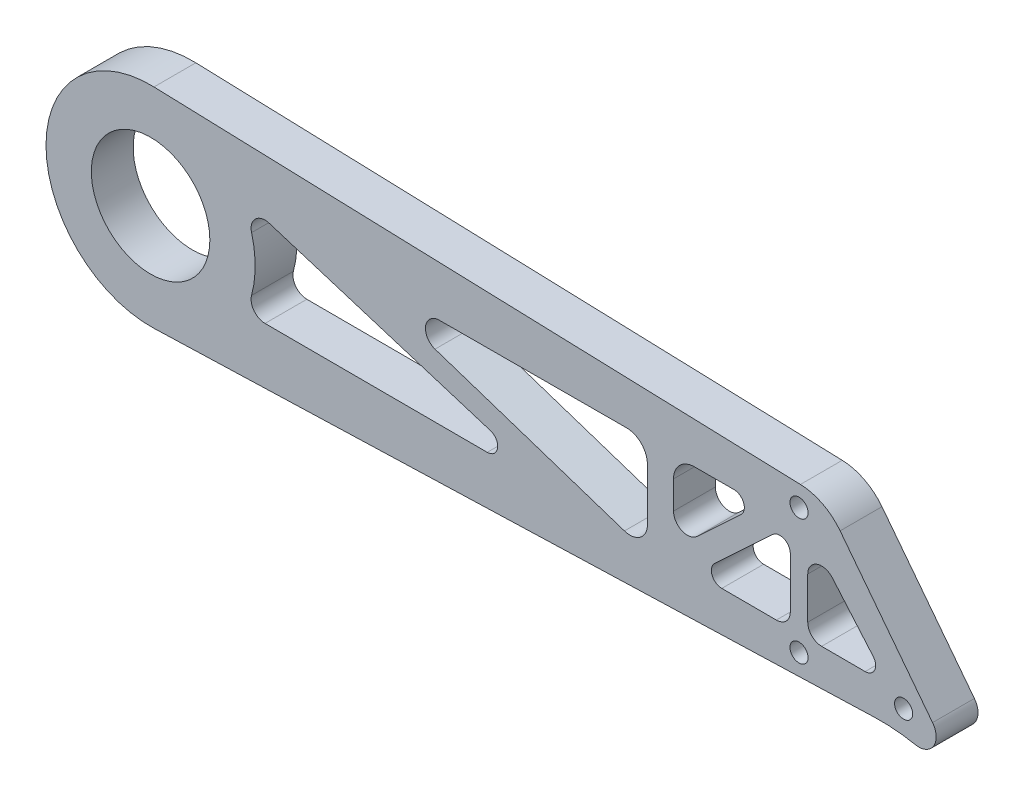
from build123d import *

# Parameters (mm, degrees)
SKETCH_1_R           = 2.6
EXTRUDE_1_DEPTH      = 12
SKETCH_2_R           = 17
CUT_EXTRUDE_1_DEPTH  = 319.424245308
FILLET_1_R           = 50
SKETCH_7_R           = 21
CUT_EXTRUDE_6_DEPTH  = 319.424245308
SKETCH_15_R          = 48
CUT_EXTRUDE_12_DEPTH = 319.424245308
CUT_EXTRUDE_13_DEPTH = 234.372713636
CUT_EXTRUDE_14_DEPTH = 234.372713636
SKETCH_19_W          = 9.577046033
SKETCH_19_H          = 9.102233312
EXTRUDE_3_DEPTH      = 1
CUT_EXTRUDE_16_DEPTH = 234.372713636
FILLET_11_R          = 5
FILLET_12_R          = 15
FILLET_13_R          = 5


with BuildPart() as part:
    # 草图1 → 凸台-拉伸1 (new body)
    with BuildSketch(Plane.XY):
        with BuildLine():
            Line((0.975449173, 29.984137455), (231.02885683, 22.5))
            ThreePointArc((231.02885683, 22.5), (315, 0), (231.02885683, -22.5))
            Line((231.02885683, -22.5), (0.975449173, -29.984137455))
            ThreePointArc((0.975449173, -29.984137455), (-30, 0), (0.975449173, 29.984137455))
        make_face()
        with Locations((186, 18)):
            Circle(SKETCH_1_R, mode=Mode.SUBTRACT)
        with Locations(Location((186, -18, 0), (0, 0, 180))):
            Circle(SKETCH_1_R, mode=Mode.SUBTRACT)
        with Locations((216, -16.952376915)):
            Circle(SKETCH_1_R, mode=Mode.SUBTRACT)
    extrude(amount=EXTRUDE_1_DEPTH)

    # 草图2 → 切除-拉伸1 (cut, through all)
    with BuildSketch(Plane.XY.offset(12)):
        Circle(SKETCH_2_R)
    extrude(amount=-CUT_EXTRUDE_1_DEPTH, mode=Mode.SUBTRACT)

    # Fillet 1
    fillet_1_edges = [part.edges().sort_by_distance(p)[0] for p in [
        (231.02885683, 22.5, 6),
        (231.02885683, -22.5, 6),
    ]]
    fillet(fillet_1_edges, radius=FILLET_1_R)

    # 草图7 → 切除-拉伸6 (cut, through all)
    with BuildSketch(Plane.XY.offset(12)):
        with Locations((270, 0)):
            Circle(SKETCH_7_R)
    extrude(amount=-CUT_EXTRUDE_6_DEPTH, mode=Mode.SUBTRACT)

    # 草图15 → 切除-拉伸12 (cut, through all)
    with BuildSketch(Plane(origin=(0, 0, 0), x_dir=(-1, 0, 0), z_dir=(0, 0, -1))):
        with Locations((-270, 0)):
            Circle(SKETCH_15_R)
    extrude(amount=-CUT_EXTRUDE_12_DEPTH, mode=Mode.SUBTRACT)

    # 草图16 → 切除-拉伸13 (cut, through all)
    with BuildSketch(Plane(origin=(0, 0, 0), x_dir=(-1, 0, 0), z_dir=(0, 0, -1))):
        with BuildLine():
            ThreePointArc((-222, 0), (-224.338232659, 14.798750059), (-231.125125138, 28.155711755))
            ThreePointArc((-231.125125138, 28.155711755), (-223.636221951, 25.273493876), (-215.782692909, 23.62639569))
            ThreePointArc((-215.782692909, 23.62639569), (-220.419657795, 12.215374337), (-222, 0))
        make_face()
    extrude(amount=-CUT_EXTRUDE_13_DEPTH, mode=Mode.SUBTRACT)

    # 草图17 → 切除-拉伸14 (cut, through all)
    with BuildSketch(Plane(origin=(0, 0, 0), x_dir=(-1, 0, 0), z_dir=(0, 0, -1))):
        with BuildLine():
            ThreePointArc((-188.5, 2.750055906), (-191.110952969, 6.501128866), (-195.535274173, 5.355264285))
            Line((-195.535274173, 5.355264285), (-207.249830265, -8.293121713))
            ThreePointArc((-207.249830265, -8.293121713), (-207.697838632, -11.502932426), (-204.966217001, -13.247019458))
            Line((-204.966217001, -13.247019458), (-192.490456487, -13.217253727))
            ThreePointArc((-192.490456487, -13.217253727), (-189.668200744, -12.04231608), (-188.5, -9.217265111))
            Line((-188.5, -9.217265111), (-188.5, 2.750055906))
        make_face()
        with BuildLine():
            ThreePointArc((-178.455108958, 7.554652032), (-181.696939195, 8.110441149), (-183.5, 5.359561914))
            Line((-183.5, 5.359561914), (-183.5, -9.186248604))
            ThreePointArc((-183.5, -9.186248604), (-182.325050968, -12.018047861), (-179.490456487, -13.18623722))
            Line((-179.490456487, -13.18623722), (-163.845250629, -13.148909555))
            ThreePointArc((-163.845250629, -13.148909555), (-161.059570263, -11.244388724), (-161.807517222, -7.953827976))
            Line((-161.807517222, -7.953827976), (-178.455108958, 7.554652032))
        make_face()
        with BuildLine():
            Line((-155.98568473, 13.130157534), (-167.304455128, 13.15716282))
            ThreePointArc((-167.304455128, 13.15716282), (-170.101829155, 11.259302243), (-169.356503805, 7.96208124))
            Line((-169.356503805, 7.96208124), (-156.726521389, -3.803694429))
            ThreePointArc((-156.726521389, -3.803694429), (-152.404081073, -4.544746584), (-150, -0.876907605))
            Line((-150, -0.876907605), (-150, 7.130174611))
            ThreePointArc((-150, 7.130174611), (-151.752301116, 11.367751063), (-155.98568473, 13.130157534))
        make_face()
        with BuildLine():
            ThreePointArc((-136.48568473, 13.083632773), (-140.737576452, 11.331348735), (-142.5, 7.083649851))
            Line((-142.5, 7.083649851), (-142.5, -8.086038582))
            ThreePointArc((-142.5, -8.086038582), (-140.427707672, -12.139250616), (-135.928588884, -12.832686568))
            Line((-135.928588884, -12.832686568), (-81.584472606, 5.158314378))
            ThreePointArc((-81.584472606, 5.158314378), (-78.891840256, 9.587602802), (-82.832057986, 12.955621382))
            Line((-82.832057986, 12.955621382), (-136.48568473, 13.083632773))
        make_face()
        with BuildLine():
            ThreePointArc((-97.462029586, -7.12436313), (-99.534348383, -10.443548142), (-96.561920261, -12.988379256))
            Line((-96.561920261, -12.988379256), (-32.822141486, -12.836303465))
            ThreePointArc((-32.822141486, -12.836303465), (-29.654019481, -11.265809006), (-28.969133823, -7.796748397))
            ThreePointArc((-28.969133823, -7.796748397), (-30, 0), (-28.969133823, 7.796748397))
            ThreePointArc((-28.969133823, 7.796748397), (-30.059408875, 11.719799736), (-34.022287252, 12.655014403))
            Line((-34.022287252, 12.655014403), (-97.462029586, -7.12436313))
        make_face()
    extrude(amount=-CUT_EXTRUDE_14_DEPTH, mode=Mode.SUBTRACT)

    # 草图21 → 切除-拉伸16 (cut, through all)
    with BuildSketch(Plane.XY.offset(12)):
        with BuildLine():
            Line((225.346998742, -17.609925571), (193.471450892, 23.72182406))
            Line((193.471450892, 23.72182406), (207.853731728, 23.253937199))
            ThreePointArc((207.853731728, 23.253937199), (211.825615161, 23.282573441), (215.782692909, 23.62639569))
            ThreePointArc((215.782692909, 23.62639569), (220.419657795, 12.215374337), (222, 0))
            ThreePointArc((222, 0), (222.844172892, -8.962587227), (225.346998742, -17.609925571))
        make_face()
    extrude(amount=-CUT_EXTRUDE_16_DEPTH, mode=Mode.SUBTRACT)

    # 圆角11
    # the kernel refuses this fillet: 5 mm, written as the material it takes off along each edge
    with BuildSketch(Plane(origin=(231.125125138, -28.155711755, -30.280019258), x_dir=(-0.9472337070589926, 0.3205437633323705, 0), z_dir=(0, 0, 1))) as fillet_11_piece_1:
        with BuildLine():
            CenterArc((12.717608088, -4.963189315), FILLET_11_R, 96.956749804, 123.184808142)
            ThreePointArc((8.895338078, -8.186580691), (4.706429893, -3.812127139), (0, 0))
            ThreePointArc((0, 0), (6.056003852, -0.368106853), (12.112007703, 0))
        make_face()
    extrude(amount=72.560038515, mode=Mode.SUBTRACT)

    # 圆角12
    fillet_12_edges = [part.edges().sort_by_distance(p)[0] for p in [
        (193.471450892, 23.72182406, 6),
    ]]
    fillet(fillet_12_edges, radius=FILLET_12_R)

    # 圆角13
    fillet_13_edges = [part.edges().sort_by_distance(p)[0] for p in [
        (225.346030547, -17.608670152, 6),
    ]]
    fillet(fillet_13_edges, radius=FILLET_13_R)


with BuildPart() as body_2:
    # 草图19 → 凸台-拉伸3 (new body)
    with BuildSketch(Plane(origin=(0, 0, 0), x_dir=(0, 0, -1), z_dir=(1, 0, 0))):
        with Locations((4.788523017, -4.551116656)):
            Rectangle(SKETCH_19_W, SKETCH_19_H)
    extrude(amount=EXTRUDE_3_DEPTH)


solid = part.part
